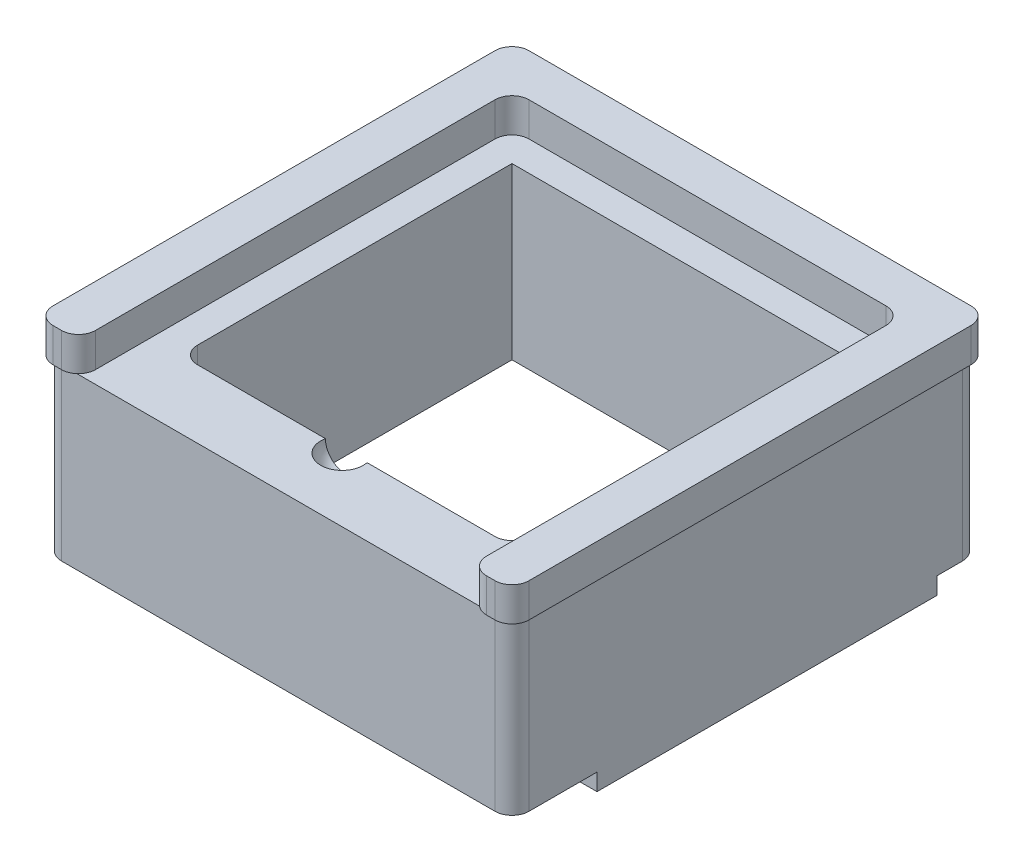
from build123d import *
from build123d.topology import SkipClean

# Parameters (mm, degrees)
BOSS_EXTRUDE1_DEPTH = 2
SKETCH3_W           = 27.5
SKETCH3_H           = 27.5
SKETCH3_W_2         = 19.5
SKETCH3_H_2         = 19.5
BOSS_EXTRUDE2_DEPTH = 10
SKETCH4_W           = 1
SKETCH4_H           = 20
BOSS_EXTRUDE3_DEPTH = 1
FILLET2_R           = 1


with BuildPart() as part:
    # Sketch1 → Boss-Extrude1 (new body)
    with BuildSketch(Plane(origin=(0, 0, 0), x_dir=(1, 0, 0), z_dir=(0, 1, 0))):
        Polygon((-14, 14), (-14, -14), (-11.5, -14), (-11.5, 11.5), (11.5, 11.5), (11.5, -14), (14, -14), (14, 14), align=None)
    extrude(amount=BOSS_EXTRUDE1_DEPTH)

    # Sketch3 → Boss-Extrude2 (add)
    with BuildSketch(Plane.XZ):
        Rectangle(SKETCH3_W, SKETCH3_H)
        Rectangle(SKETCH3_W_2, SKETCH3_H_2, mode=Mode.SUBTRACT)
    extrude(amount=BOSS_EXTRUDE2_DEPTH)

    # Sketch4 → Boss-Extrude3 (add)
    with BuildSketch(Plane.XZ.offset(10)):
        with Locations((-13.25, -1.25)):
            Rectangle(SKETCH4_W, SKETCH4_H)
        with Locations((13.25, -1.25)):
            Rectangle(SKETCH4_W, SKETCH4_H)
    extrude(amount=BOSS_EXTRUDE3_DEPTH)

    # Sketch5 → Cut-Revolve4 (revolve, cut)
    with SkipClean():  # the faces are left unmerged after this step: merging them gives an invalid solid
        with BuildSketch(Plane(origin=(0, 0, 0), x_dir=(0, 0, -1), z_dir=(1, 0, 0))):
            with BuildLine():
                ThreePointArc((-8.75, 0), (-10, 1.25), (-11.25, 0))
                Line((-11.25, 0), (-8.75, 0))
            make_face()
            with BuildLine():
                Line((-8.75, 0), (-11.25, 0))
                ThreePointArc((-11.25, 0), (-10, -1.25), (-8.75, 0))
            make_face()
        revolve(axis=Axis((0, 0, 1000), (0, 0, -1)), mode=Mode.SUBTRACT)
    add(part.part.scale(1), mode=Mode.REPLACE)  # the faces are merged on a copy

    # Fillet2
    # the kernel refuses this fillet: 1 mm, written as the material it adds along each edge
    with BuildSketch(Plane(origin=(11.5, -2.5, -11.5), x_dir=(0, 0, 1), z_dir=(0, 1, 0))) as fillet2_piece_1:
        with BuildLine():
            CenterArc((FILLET2_R, -FILLET2_R), FILLET2_R, 90, 90)
            Line((0, -FILLET2_R), (0, 0))
            Line((0, 0), (FILLET2_R, 0))
        make_face()
    extrude(amount=4.5)
    with BuildSketch(Plane(origin=(-11.5, -2.5, -11.5), x_dir=(0, 0, 1), z_dir=(0, 1, 0))) as fillet2_piece_2:
        with BuildLine():
            CenterArc((FILLET2_R, FILLET2_R), FILLET2_R, 180, 90)
            Line((0, FILLET2_R), (0, 0))
            Line((0, 0), (FILLET2_R, 0))
        make_face()
    extrude(amount=4.5)
    with BuildSketch(Plane(origin=(-9.75, 0, 9.75), x_dir=(0, 0, -1), z_dir=(0, -1, 0))) as fillet2_piece_3:
        with BuildLine():
            CenterArc((FILLET2_R, FILLET2_R), FILLET2_R, 180, 90)
            Line((0, FILLET2_R), (0, 0))
            Line((0, 0), (FILLET2_R, 0))
        make_face()
    extrude(amount=10)
    with BuildSketch(Plane(origin=(9.75, 0, 9.75), x_dir=(0, 0, -1), z_dir=(0, -1, 0))) as fillet2_piece_4:
        with BuildLine():
            CenterArc((FILLET2_R, -FILLET2_R), FILLET2_R, 90, 90)
            Line((0, -FILLET2_R), (0, 0))
            Line((0, 0), (FILLET2_R, 0))
        make_face()
    extrude(amount=10)
    # the kernel refuses this fillet: 1 mm, written as the material it takes off along each edge
    with BuildSketch(Plane(origin=(-11.5, 0, 14), x_dir=(-1, 0, 0), z_dir=(0, 1, 0))) as fillet2_2_piece_1:
        with BuildLine():
            CenterArc((FILLET2_R, -FILLET2_R), FILLET2_R, 90, 90)
            Line((0, -FILLET2_R), (0, 0))
            Line((0, 0), (FILLET2_R, 0))
        make_face()
    extrude(amount=4.5, mode=Mode.SUBTRACT)
    with BuildSketch(Plane(origin=(-14, -2.5, 14), x_dir=(0, 0, -1), z_dir=(0, 1, 0))) as fillet2_2_piece_2:
        with BuildLine():
            CenterArc((FILLET2_R, -FILLET2_R), FILLET2_R, 90, 90)
            Line((0, -FILLET2_R), (0, 0))
            Line((0, 0), (FILLET2_R, 0))
        make_face()
    extrude(amount=7, mode=Mode.SUBTRACT)
    with BuildSketch(Plane(origin=(-14, -2.5, -14), x_dir=(0, 0, 1), z_dir=(0, 1, 0)), Plane(origin=(14, -2.5, -14), x_dir=(-1, 0, 0), z_dir=(0, 1, 0)), Plane(origin=(14, -2.5, 14), x_dir=(0, 0, -1), z_dir=(0, 1, 0))) as fillet2_2_piece_3:
        with BuildLine():
            CenterArc((FILLET2_R, FILLET2_R), FILLET2_R, 180, 90)
            Line((0, FILLET2_R), (0, 0))
            Line((0, 0), (FILLET2_R, 0))
        make_face()
    extrude(amount=7, mode=Mode.SUBTRACT)
    with BuildSketch(Plane(origin=(11.5, 0, 14), x_dir=(1, 0, 0), z_dir=(0, 1, 0))) as fillet2_2_piece_4:
        with BuildLine():
            CenterArc((FILLET2_R, FILLET2_R), FILLET2_R, 180, 90)
            Line((0, FILLET2_R), (0, 0))
            Line((0, 0), (FILLET2_R, 0))
        make_face()
    extrude(amount=4.5, mode=Mode.SUBTRACT)
    with BuildSketch(Plane(origin=(13.75, 0, 13.75), x_dir=(-1, 0, 0), z_dir=(0, -1, 0)), Plane(origin=(-13.75, 0, -13.75), x_dir=(1, 0, 0), z_dir=(0, -1, 0)), Plane(origin=(13.75, 0, -13.75), x_dir=(0, 0, 1), z_dir=(0, -1, 0))) as fillet2_2_piece_5:
        with BuildLine():
            CenterArc((FILLET2_R, FILLET2_R), FILLET2_R, 180, 90)
            Line((0, FILLET2_R), (0, 0))
            Line((0, 0), (FILLET2_R, 0))
        make_face()
    extrude(amount=12.5, mode=Mode.SUBTRACT)
    with BuildSketch(Plane(origin=(-13.75, 0, 13.75), x_dir=(1, 0, 0), z_dir=(0, -1, 0))) as fillet2_2_piece_6:
        with BuildLine():
            CenterArc((FILLET2_R, -FILLET2_R), FILLET2_R, 90, 90)
            Line((0, -FILLET2_R), (0, 0))
            Line((0, 0), (FILLET2_R, 0))
        make_face()
    extrude(amount=12.5, mode=Mode.SUBTRACT)


solid = part.part
